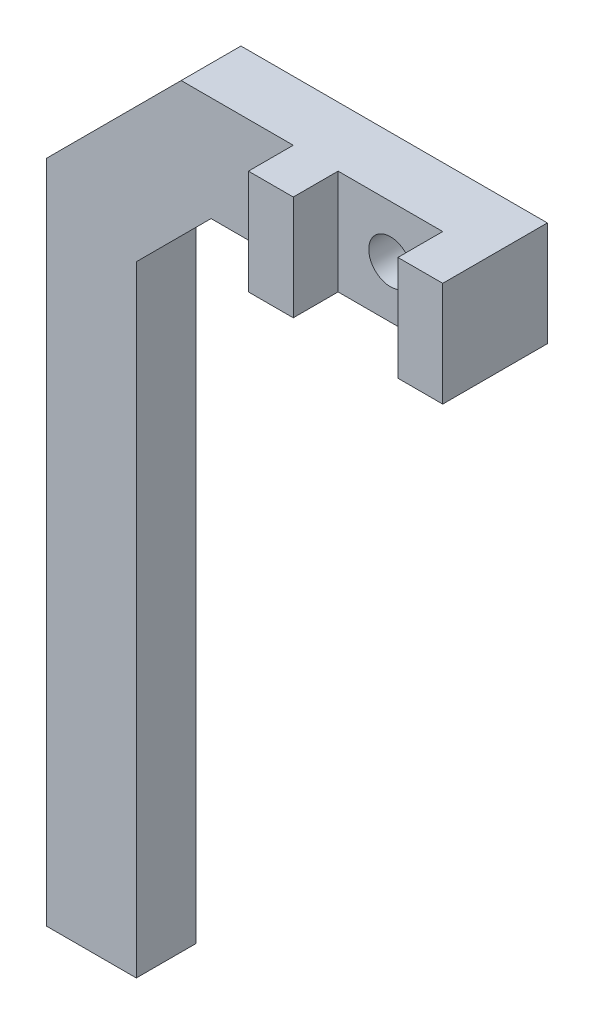
from build123d import *

# Parameters (mm, degrees)
SKETCH2_W           = 18.5
SKETCH2_H           = 7
SKETCH2_R           = 1.45
BOSS_EXTRUDE2_DEPTH = 4
SKETCH4_W           = 3
SKETCH4_H           = 7
BOSS_EXTRUDE3_DEPTH = 7
SKETCH5_W           = 2
SKETCH5_H           = 7
SKETCH5_W_2         = 6
SKETCH5_H_2         = 54.5
BOSS_EXTRUDE4_DEPTH = 4
FILLET1_DEPTH       = 4
CHAMFER1_SIZE       = 9
CHAMFER6_SIZE       = 1


with BuildPart() as part:
    # Sketch2 → Boss-Extrude2 (new body)
    with BuildSketch(Plane.XY):
        with Locations((-5.75, 9)):
            Rectangle(SKETCH2_W, SKETCH2_H)
        with Locations((0, 9)):
            Circle(SKETCH2_R, mode=Mode.SUBTRACT)
    extrude(amount=BOSS_EXTRUDE2_DEPTH)

    # Sketch4 → Boss-Extrude3 (add)
    with BuildSketch(Plane.XY):
        with Locations((5, 9)):
            Rectangle(SKETCH4_W, SKETCH4_H)
        with Locations((-5, 9)):
            Rectangle(SKETCH4_W, SKETCH4_H)
    extrude(amount=BOSS_EXTRUDE3_DEPTH)

    # Sketch5 → Boss-Extrude4 (add)
    with BuildSketch(Plane.XY):
        with Locations((-16, 9)):
            Rectangle(SKETCH5_W, SKETCH5_H)
        with Locations((-20, -14.75)):
            Rectangle(SKETCH5_W_2, SKETCH5_H_2)
    extrude(amount=BOSS_EXTRUDE4_DEPTH)

    # Fillet1: read off the stored shape, not the designer's step
    # Fillet1 outline → Fillet1 (add)
    with BuildSketch(Plane.XY):
        with BuildLine():
            add(Edge.make_bspline(
                [(-12, 5.5), (-17, 5.5), (-17, 0.5)],
                knots=[0, 0, 0, 1, 1, 1], degree=2, weights=[1, 0.000353553, 1]))
            Line((-12, 5.5), (-17, 5.5))
            Line((-17, 5.5), (-17, 0.5))
        make_face()
    extrude(amount=FILLET1_DEPTH)

    # Chamfer1
    chamfer1_edges = [part.edges().sort_by_distance(p)[0] for p in [
        (-23, 12.5, 2),
    ]]
    chamfer(chamfer1_edges, length=CHAMFER1_SIZE)

    # Chamfer6
    chamfer6_edges = [part.edges().sort_by_distance(p)[0] for p in [
        (-20, -42, 4),
        (-23, -42, 2),
        (-17, -42, 2),
        (-20, -42, 0),
    ]]
    chamfer(chamfer6_edges, length=CHAMFER6_SIZE)


solid = part.part
